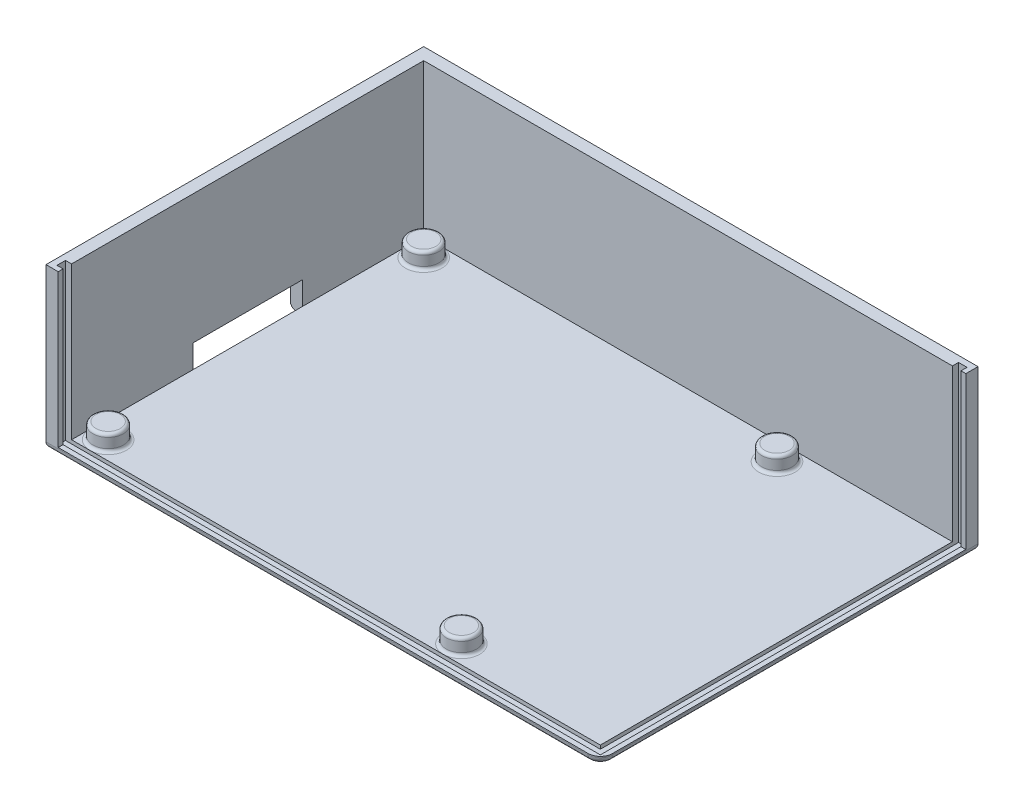
from build123d import *

# Parameters (mm, degrees)
SKICA1_W                 = 91
SKICA1_H                 = 62
P_IDAT_VYSUNUT_M5_DEPTH  = 1.2
P_IDAT_VYSUNUT_M8_DEPTH  = 25
ODEBRAT_START            = -0.6
SKICA13_W                = 87.8
SKICA13_H                = 1.4
ODEBRAT_VYSUNUT_M2_DEPTH = 25.6
CUT_EXTRUDE2_REACH       = 113.586
SKETCH2_W                = 18
SKETCH2_H                = 5
SKETCH4_R                = 2.5
ODEBRAT_VYSUNUT_M6_DEPTH = 0.4
BOSS_EXTRUDE3_START      = 3
SKETCH17_R               = 2.5
BOSS_EXTRUDE3_DEPTH      = 3
FILLET24_R               = 0.5
FILLET25_R               = 0.5
FILLET2_R                = 1
FILLET5_R                = 2


# Some blends are built 0.0001 mm under size
with BuildPart() as part:
    # Skica1 → Přidat vysunutím5 (new body)
    with BuildSketch(Plane(origin=(0, 0, 0), x_dir=(1, 0, 0), z_dir=(0, 1, 0))):
        with Locations((45.5, 31)):
            Rectangle(SKICA1_W, SKICA1_H)
    extrude(amount=P_IDAT_VYSUNUT_M5_DEPTH)

    # Skica5 → Přidat vysunutím8 (add)
    with BuildSketch(Plane(origin=(0, 1.2, 0), x_dir=(1, 0, 0), z_dir=(0, 1, 0))):
        Polygon((0, 62), (0, 0), (2, 0), (2, 60), (91, 60), (91, 62), align=None)
    extrude(amount=P_IDAT_VYSUNUT_M8_DEPTH)

    # Skica13 → Odebrat vysunutím2 (cut)
    with BuildSketch(Plane(origin=(0, 1.2, 0), x_dir=(1, 0, 0), z_dir=(0, 1, 0)).offset(ODEBRAT_START)):
        with Locations((44.9, 1.5)):
            Rectangle(SKICA13_W, SKICA13_H)
        Polygon((88.8, 2.2), (88.8, 0.8), (90.2, 0.8), (90.2, 61), (88.8, 61), align=None)
    extrude(amount=ODEBRAT_VYSUNUT_M2_DEPTH, mode=Mode.SUBTRACT)

    # Sketch2 → Cut-Extrude2 (cut, up to next)
    with BuildSketch(Plane(origin=(2, 0, 0), x_dir=(0, 0, -1), z_dir=(1, 0, 0)), mode=Mode.PRIVATE) as cut_extrude2_sk1:
        with Locations((31.1, 2.5)):
            Rectangle(SKETCH2_W, SKETCH2_H)
    cut_extrude2_tool1 = extrude(cut_extrude2_sk1.sketch, amount=-CUT_EXTRUDE2_REACH, mode=Mode.PRIVATE) & part.part
    add(cut_extrude2_tool1.solids().sort_by_distance((2, 2.5, -31.1))[0], mode=Mode.SUBTRACT)

    # Sketch4 → Odebrat vysunutím6 (cut)
    with BuildSketch(Plane(origin=(0, 1.2, 0), x_dir=(1, 0, 0), z_dir=(0, 1, 0))):
        with Locations(Location((63, 5.2, 0), (0, 0, 270))):
            Circle(SKETCH4_R)
        with Locations(Location((63, 57, 0), (0, 0, 90))):
            Circle(SKETCH4_R)
        with Locations(Location((5, 5.2, 0), (0, 0, 270))):
            Circle(SKETCH4_R)
        with Locations(Location((5, 57, 0), (0, 0, 90))):
            Circle(SKETCH4_R)
    extrude(amount=-ODEBRAT_VYSUNUT_M6_DEPTH, mode=Mode.SUBTRACT)

    # Sketch17 → Boss-Extrude3 (add)
    with BuildSketch(Plane(origin=(0, 0.8, 0), x_dir=(1, 0, 0), z_dir=(0, 1, 0)).offset(BOSS_EXTRUDE3_START)):
        with Locations(Location((5, 5.2, 0), (0, 0, 270))):
            Circle(SKETCH17_R)
        with Locations(Location((5, 57, 0), (0, 0, 90))):
            Circle(SKETCH17_R)
        with Locations(Location((63, 57, 0), (0, 0, 90))):
            Circle(SKETCH17_R)
        with Locations(Location((63, 5.2, 0), (0, 0, 90))):
            Circle(SKETCH17_R)
    extrude(amount=-BOSS_EXTRUDE3_DEPTH)

    # Fillet24
    fillet24_edges = [part.edges().sort_by_distance(p)[0] for p in [
        (63, 1.2, -54.5),
        (5, 1.2, -7.7),
        (5, 1.2, -54.5),
        (63, 1.2, -2.7),
    ]]
    fillet(fillet24_edges, radius=FILLET24_R - 0.0001)  # a hair under: the kernel refuses the full size

    # Fillet25
    fillet25_edges = [part.edges().sort_by_distance(p)[0] for p in [
        (5, 3.8, -54.5),
        (63, 3.8, -54.5),
        (63, 3.8, -2.7),
        (5, 3.8, -7.7),
    ]]
    fillet(fillet25_edges, radius=FILLET25_R)

    # Fillet2
    fillet2_edges = [part.edges().sort_by_distance(p)[0] for p in [
        (45.5, 0, 0),
        (91, 0, -31),
        (45.5, 0, -62),
        (0, 0, -11.05),
        (0, 0, -51.05),
    ]]
    fillet(fillet2_edges, radius=FILLET2_R)

    # Fillet5
    # the kernel refuses this fillet: 2 mm, written as the material it takes off along each edge
    with BuildSketch(Plane(origin=(89, 0, -2), x_dir=(1, 0, 0), z_dir=(0, 0, -1))) as fillet5_piece_1:
        with BuildLine():
            CenterArc((1, -1), 1, 0, 90)
            Line((2, -1), (2, 0))
            Line((2, 0), (1, 0))
        make_face()
    revolve(axis=Axis((89, 0, -2), (0, -1, 0)), revolution_arc=90, mode=Mode.SUBTRACT)
    with BuildSketch(Plane(origin=(91, 0, 0), x_dir=(-1, 0, 0), z_dir=(0, 1, 0))) as fillet5_piece_2:
        with BuildLine():
            CenterArc((FILLET5_R, -FILLET5_R), FILLET5_R, 90, 90)
            Line((0, -FILLET5_R), (0, 0))
            Line((0, 0), (FILLET5_R, 0))
        make_face()
    extrude(amount=6.2, mode=Mode.SUBTRACT)


solid = part.part
